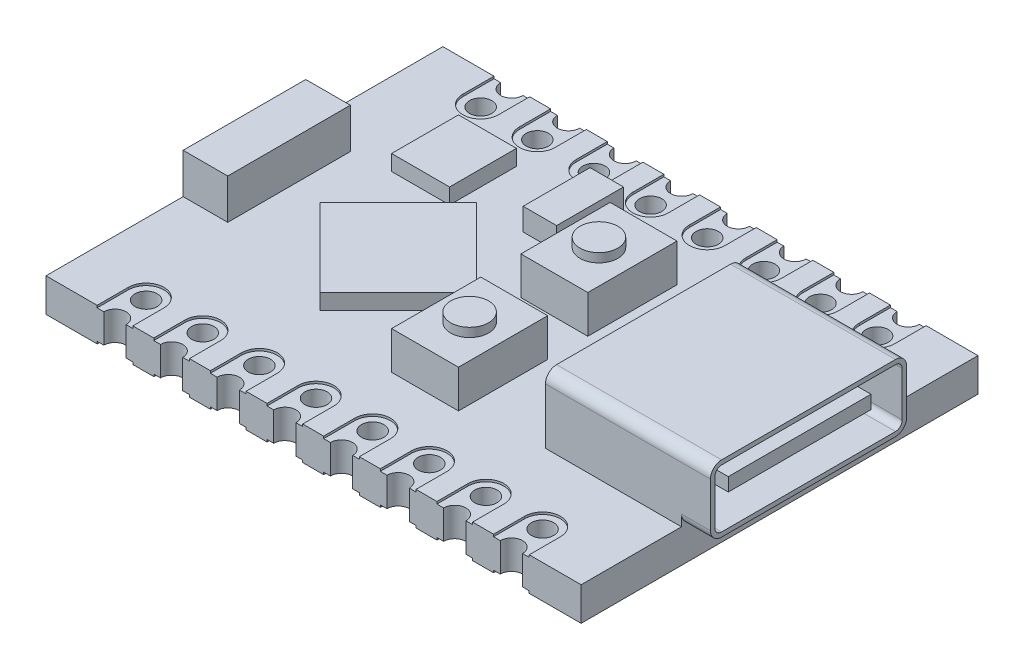
from build123d import *

# Parameters (mm, degrees)
SKETCH2_W             = 24
SKETCH2_H             = 17.8
BOSS_EXTRUDE1_DEPTH   = 1.5
SKETCH3_W             = 2
SKETCH3_H             = 5.5
BOSS_EXTRUDE2_DEPTH   = 1.8
BOSS_EXTRUDE3_DEPTH   = 0.7
SKETCH5_W             = 2.6
SKETCH5_H             = 3
BOSS_EXTRUDE4_DEPTH   = 0.7
SKETCH6_W             = 1.5
SKETCH6_H             = 3
BOSS_EXTRUDE5_DEPTH   = 1
SKETCH7_W             = 3
SKETCH7_H             = 4
BOSS_EXTRUDE6_DEPTH   = 1.7
SKETCH8_R             = 0.85
BOSS_EXTRUDE7_DEPTH   = 0.4
SKETCH9_R             = 0.5
CUT_EXTRUDE1_DEPTH    = 30.954131602
CUT_EXTRUDE2_DEPTH    = 0.1
LPATTERN1_COUNT       = 8
LPATTERN1_PITCH       = 2.54
SKETCH11_R            = 0.5
CUT_EXTRUDE3_DEPTH    = 30.954131602
MIRROR2_COPY_1_DEPTH  = 0.1
MIRROR2_COPY_2_DEPTH  = 0.1
MIRROR2_COPY_3_DEPTH  = 0.1
MIRROR2_COPY_4_DEPTH  = 0.1
MIRROR2_COPY_5_DEPTH  = 0.1
MIRROR2_COPY_6_DEPTH  = 0.1
MIRROR2_COPY_7_DEPTH  = 0.1
MIRROR2_COPY_8_DEPTH  = 0.1
MIRROR3_COPY_1_DEPTH  = 0.1
MIRROR3_COPY_2_DEPTH  = 0.1
MIRROR3_COPY_3_DEPTH  = 0.1
MIRROR3_COPY_4_DEPTH  = 0.1
MIRROR3_COPY_5_DEPTH  = 0.1
MIRROR3_COPY_6_DEPTH  = 0.1
MIRROR3_COPY_7_DEPTH  = 0.1
MIRROR3_COPY_8_DEPTH  = 0.1
MIRROR3_COPY_9_DEPTH  = 0.1
MIRROR3_COPY_10_DEPTH = 0.1
MIRROR3_COPY_11_DEPTH = 0.1
MIRROR3_COPY_12_DEPTH = 0.1
MIRROR3_COPY_13_DEPTH = 0.1
MIRROR3_COPY_14_DEPTH = 0.1
MIRROR3_COPY_15_DEPTH = 0.1
SKETCH12_W            = 8.8
SKETCH12_H            = 3
BOSS_EXTRUDE8_DEPTH   = 7.4
FILLET1_R             = 0.5
CUT_EXTRUDE4_DEPTH    = 6.4
SKETCH14_W            = 6.4
SKETCH14_H            = 0.6
BOSS_EXTRUDE9_DEPTH   = 6
SKETCH15_W            = 5.5
SKETCH15_H            = 0.01
CUT_EXTRUDE5_DEPTH    = 0.01


with BuildPart() as part:
    # Sketch2 → Boss-Extrude1 (new body)
    with BuildSketch(Plane(origin=(0, 0, 0), x_dir=(1, 0, 0), z_dir=(0, 1, 0))):
        with Locations((12, 8.9)):
            Rectangle(SKETCH2_W, SKETCH2_H)
    extrude(amount=-BOSS_EXTRUDE1_DEPTH)

    # Sketch3 → Boss-Extrude2 (add)
    with BuildSketch(Plane(origin=(0, 0, 0), x_dir=(1, 0, 0), z_dir=(0, 1, 0))):
        with Locations((1, 8.9)):
            Rectangle(SKETCH3_W, SKETCH3_H)
    extrude(amount=BOSS_EXTRUDE2_DEPTH)

    # Sketch4 → Boss-Extrude3 (add)
    with BuildSketch(Plane(origin=(0, 0, 0), x_dir=(1, 0, 0), z_dir=(0, 1, 0))):
        Polygon((4, 8.3), (7.5, 11.8), (11, 8.3), (7.5, 4.8), align=None)
    extrude(amount=BOSS_EXTRUDE3_DEPTH)

    # Sketch5 → Boss-Extrude4 (add)
    with BuildSketch(Plane(origin=(0, 0, 0), x_dir=(1, 0, 0), z_dir=(0, 1, 0))):
        with Locations((5, 13.3)):
            Rectangle(SKETCH5_W, SKETCH5_H)
    extrude(amount=BOSS_EXTRUDE4_DEPTH)

    # Sketch6 → Boss-Extrude5 (add)
    with BuildSketch(Plane(origin=(0, 0, 0), x_dir=(1, 0, 0), z_dir=(0, 1, 0))):
        with Locations((9.75, 13.9)):
            Rectangle(SKETCH6_W, SKETCH6_H)
    extrude(amount=BOSS_EXTRUDE5_DEPTH)

    # Sketch7 → Boss-Extrude6 (add)
    with BuildSketch(Plane(origin=(0, 0, 0), x_dir=(1, 0, 0), z_dir=(0, 1, 0))):
        with Locations((13, 11.8)):
            Rectangle(SKETCH7_W, SKETCH7_H)
    boss_extrude6 = extrude(amount=BOSS_EXTRUDE6_DEPTH)

    # Sketch8 → Boss-Extrude7 (add)
    with BuildSketch(Plane(origin=(0, 1.7, 0), x_dir=(1, 0, 0), z_dir=(0, 1, 0))):
        with Locations((13, 11.8)):
            Circle(SKETCH8_R)
    boss_extrude7 = extrude(amount=BOSS_EXTRUDE7_DEPTH)

    # Mirror1: Boss-Extrude6, Boss-Extrude7 across plane
    add(boss_extrude6.mirror(Plane(origin=(0, 0, -8.9), x_dir=(1, 0, 0), z_dir=(0, 0, -1))))
    add(boss_extrude7.mirror(Plane(origin=(0, 0, -8.9), x_dir=(1, 0, 0), z_dir=(0, 0, -1))))

    # Sketch9 → Cut-Extrude1 (cut, through all)
    with BuildSketch(Plane(origin=(0, 0, 0), x_dir=(1, 0, 0), z_dir=(0, 1, 0))):
        with Locations((3.093060381, 16.402666124)):
            Circle(SKETCH9_R)
        with Locations((5.633060381, 16.402666124)):
            Circle(SKETCH9_R)
        with Locations((8.173060381, 16.402666124)):
            Circle(SKETCH9_R)
        with Locations((10.713060381, 16.402666124)):
            Circle(SKETCH9_R)
        with Locations((13.253060381, 16.402666124)):
            Circle(SKETCH9_R)
        with Locations((15.793060381, 16.402666124)):
            Circle(SKETCH9_R)
        with Locations((18.333060381, 16.402666124)):
            Circle(SKETCH9_R)
        with Locations((20.873060381, 16.402666124)):
            Circle(SKETCH9_R)
    cut_extrude1 = extrude(amount=-CUT_EXTRUDE1_DEPTH, mode=Mode.SUBTRACT)

    # Sketch10 → Cut-Extrude2 (cut)
    with BuildSketch(Plane(origin=(0, 0, 0), x_dir=(1, 0, 0), z_dir=(0, 1, 0))):
        with BuildLine():
            Line((2.293060381, 16.402666124), (2.293060381, 17.8))
            Line((2.293060381, 17.8), (3.893060381, 17.8))
            Line((3.893060381, 17.8), (3.893060381, 16.402666124))
            ThreePointArc((3.893060381, 16.402666124), (3.093060381, 15.602666124), (2.293060381, 16.402666124))
        make_face()
    cut_extrude2 = extrude(amount=-CUT_EXTRUDE2_DEPTH, mode=Mode.SUBTRACT)

    # LPattern1: Cut-Extrude2 ×8
    with Locations(*[(i * LPATTERN1_PITCH, 0, 0) for i in range(1, LPATTERN1_COUNT)]):
        add(cut_extrude2, mode=Mode.SUBTRACT)

    # Sketch11 → Cut-Extrude3 (cut, through all)
    with BuildSketch(Plane(origin=(0, 0, 0), x_dir=(1, 0, 0), z_dir=(0, 1, 0))):
        with Locations((3.093060381, 17.8)):
            Circle(SKETCH11_R)
        with Locations((5.633060381, 17.8)):
            Circle(SKETCH11_R)
        with Locations((8.173060381, 17.8)):
            Circle(SKETCH11_R)
        with Locations((10.713060381, 17.8)):
            Circle(SKETCH11_R)
        with Locations((13.253060381, 17.8)):
            Circle(SKETCH11_R)
        with Locations((15.793060381, 17.8)):
            Circle(SKETCH11_R)
        with Locations((18.333060381, 17.8)):
            Circle(SKETCH11_R)
        with Locations((20.873060381, 17.8)):
            Circle(SKETCH11_R)
    cut_extrude3 = extrude(amount=-CUT_EXTRUDE3_DEPTH, mode=Mode.SUBTRACT)

    # Mirror2 copy 1 sketch → Mirror2 copy 1 (cut)
    with BuildSketch(Plane(origin=(2.54, -1.5, 0), x_dir=(1, 0, 0), z_dir=(0, -1, 0))):
        with BuildLine():
            Line((2.293060381, -16.402666124), (2.293060381, -17.8))
            Line((2.293060381, -17.8), (3.893060381, -17.8))
            Line((3.893060381, -17.8), (3.893060381, -16.402666124))
            ThreePointArc((3.893060381, -16.402666124), (3.093060381, -15.602666124), (2.293060381, -16.402666124))
        make_face()
    extrude(amount=-MIRROR2_COPY_1_DEPTH, mode=Mode.SUBTRACT)

    # Mirror2 copy 2 sketch → Mirror2 copy 2 (cut)
    with BuildSketch(Plane(origin=(5.08, -1.5, 0), x_dir=(1, 0, 0), z_dir=(0, -1, 0))):
        with BuildLine():
            Line((2.293060381, -16.402666124), (2.293060381, -17.8))
            Line((2.293060381, -17.8), (3.893060381, -17.8))
            Line((3.893060381, -17.8), (3.893060381, -16.402666124))
            ThreePointArc((3.893060381, -16.402666124), (3.093060381, -15.602666124), (2.293060381, -16.402666124))
        make_face()
    extrude(amount=-MIRROR2_COPY_2_DEPTH, mode=Mode.SUBTRACT)

    # Mirror2 copy 3 sketch → Mirror2 copy 3 (cut)
    with BuildSketch(Plane(origin=(7.62, -1.5, 0), x_dir=(1, 0, 0), z_dir=(0, -1, 0))):
        with BuildLine():
            Line((2.293060381, -16.402666124), (2.293060381, -17.8))
            Line((2.293060381, -17.8), (3.893060381, -17.8))
            Line((3.893060381, -17.8), (3.893060381, -16.402666124))
            ThreePointArc((3.893060381, -16.402666124), (3.093060381, -15.602666124), (2.293060381, -16.402666124))
        make_face()
    extrude(amount=-MIRROR2_COPY_3_DEPTH, mode=Mode.SUBTRACT)

    # Mirror2 copy 4 sketch → Mirror2 copy 4 (cut)
    with BuildSketch(Plane(origin=(10.16, -1.5, 0), x_dir=(1, 0, 0), z_dir=(0, -1, 0))):
        with BuildLine():
            Line((2.293060381, -16.402666124), (2.293060381, -17.8))
            Line((2.293060381, -17.8), (3.893060381, -17.8))
            Line((3.893060381, -17.8), (3.893060381, -16.402666124))
            ThreePointArc((3.893060381, -16.402666124), (3.093060381, -15.602666124), (2.293060381, -16.402666124))
        make_face()
    extrude(amount=-MIRROR2_COPY_4_DEPTH, mode=Mode.SUBTRACT)

    # Mirror2 copy 5 sketch → Mirror2 copy 5 (cut)
    with BuildSketch(Plane(origin=(12.7, -1.5, 0), x_dir=(1, 0, 0), z_dir=(0, -1, 0))):
        with BuildLine():
            Line((2.293060381, -16.402666124), (2.293060381, -17.8))
            Line((2.293060381, -17.8), (3.893060381, -17.8))
            Line((3.893060381, -17.8), (3.893060381, -16.402666124))
            ThreePointArc((3.893060381, -16.402666124), (3.093060381, -15.602666124), (2.293060381, -16.402666124))
        make_face()
    extrude(amount=-MIRROR2_COPY_5_DEPTH, mode=Mode.SUBTRACT)

    # Mirror2 copy 6 sketch → Mirror2 copy 6 (cut)
    with BuildSketch(Plane(origin=(15.24, -1.5, 0), x_dir=(1, 0, 0), z_dir=(0, -1, 0))):
        with BuildLine():
            Line((2.293060381, -16.402666124), (2.293060381, -17.8))
            Line((2.293060381, -17.8), (3.893060381, -17.8))
            Line((3.893060381, -17.8), (3.893060381, -16.402666124))
            ThreePointArc((3.893060381, -16.402666124), (3.093060381, -15.602666124), (2.293060381, -16.402666124))
        make_face()
    extrude(amount=-MIRROR2_COPY_6_DEPTH, mode=Mode.SUBTRACT)

    # Mirror2 copy 7 sketch → Mirror2 copy 7 (cut)
    with BuildSketch(Plane(origin=(17.78, -1.5, 0), x_dir=(1, 0, 0), z_dir=(0, -1, 0))):
        with BuildLine():
            Line((2.293060381, -16.402666124), (2.293060381, -17.8))
            Line((2.293060381, -17.8), (3.893060381, -17.8))
            Line((3.893060381, -17.8), (3.893060381, -16.402666124))
            ThreePointArc((3.893060381, -16.402666124), (3.093060381, -15.602666124), (2.293060381, -16.402666124))
        make_face()
    extrude(amount=-MIRROR2_COPY_7_DEPTH, mode=Mode.SUBTRACT)

    # Mirror2 copy 8 sketch → Mirror2 copy 8 (cut)
    with BuildSketch(Plane.XZ.offset(1.5)):
        with BuildLine():
            Line((2.293060381, -16.402666124), (2.293060381, -17.8))
            Line((2.293060381, -17.8), (3.893060381, -17.8))
            Line((3.893060381, -17.8), (3.893060381, -16.402666124))
            ThreePointArc((3.893060381, -16.402666124), (3.093060381, -15.602666124), (2.293060381, -16.402666124))
        make_face()
    extrude(amount=-MIRROR2_COPY_8_DEPTH, mode=Mode.SUBTRACT)

    # Mirror3: Cut-Extrude1, Cut-Extrude2, Cut-Extrude3 across plane
    add(cut_extrude1.mirror(Plane(origin=(0, 0, -8.9), x_dir=(1, 0, 0), z_dir=(0, 0, -1))), mode=Mode.SUBTRACT)
    add(cut_extrude2.mirror(Plane(origin=(0, 0, -8.9), x_dir=(1, 0, 0), z_dir=(0, 0, -1))), mode=Mode.SUBTRACT)
    add(cut_extrude3.mirror(Plane(origin=(0, 0, -8.9), x_dir=(1, 0, 0), z_dir=(0, 0, -1))), mode=Mode.SUBTRACT)

    # Mirror3 copy 1 sketch → Mirror3 copy 1 (cut)
    with BuildSketch(Plane(origin=(2.54, 0, -17.8), x_dir=(1, 0, 0), z_dir=(0, 1, 0))):
        with BuildLine():
            Line((2.293060381, -16.402666124), (2.293060381, -17.8))
            Line((2.293060381, -17.8), (3.893060381, -17.8))
            Line((3.893060381, -17.8), (3.893060381, -16.402666124))
            ThreePointArc((3.893060381, -16.402666124), (3.093060381, -15.602666124), (2.293060381, -16.402666124))
        make_face()
    extrude(amount=-MIRROR3_COPY_1_DEPTH, mode=Mode.SUBTRACT)

    # Mirror3 copy 2 sketch → Mirror3 copy 2 (cut)
    with BuildSketch(Plane(origin=(5.08, 0, -17.8), x_dir=(1, 0, 0), z_dir=(0, 1, 0))):
        with BuildLine():
            Line((2.293060381, -16.402666124), (2.293060381, -17.8))
            Line((2.293060381, -17.8), (3.893060381, -17.8))
            Line((3.893060381, -17.8), (3.893060381, -16.402666124))
            ThreePointArc((3.893060381, -16.402666124), (3.093060381, -15.602666124), (2.293060381, -16.402666124))
        make_face()
    extrude(amount=-MIRROR3_COPY_2_DEPTH, mode=Mode.SUBTRACT)

    # Mirror3 copy 3 sketch → Mirror3 copy 3 (cut)
    with BuildSketch(Plane(origin=(7.62, 0, -17.8), x_dir=(1, 0, 0), z_dir=(0, 1, 0))):
        with BuildLine():
            Line((2.293060381, -16.402666124), (2.293060381, -17.8))
            Line((2.293060381, -17.8), (3.893060381, -17.8))
            Line((3.893060381, -17.8), (3.893060381, -16.402666124))
            ThreePointArc((3.893060381, -16.402666124), (3.093060381, -15.602666124), (2.293060381, -16.402666124))
        make_face()
    extrude(amount=-MIRROR3_COPY_3_DEPTH, mode=Mode.SUBTRACT)

    # Mirror3 copy 4 sketch → Mirror3 copy 4 (cut)
    with BuildSketch(Plane(origin=(10.16, 0, -17.8), x_dir=(1, 0, 0), z_dir=(0, 1, 0))):
        with BuildLine():
            Line((2.293060381, -16.402666124), (2.293060381, -17.8))
            Line((2.293060381, -17.8), (3.893060381, -17.8))
            Line((3.893060381, -17.8), (3.893060381, -16.402666124))
            ThreePointArc((3.893060381, -16.402666124), (3.093060381, -15.602666124), (2.293060381, -16.402666124))
        make_face()
    extrude(amount=-MIRROR3_COPY_4_DEPTH, mode=Mode.SUBTRACT)

    # Mirror3 copy 5 sketch → Mirror3 copy 5 (cut)
    with BuildSketch(Plane(origin=(12.7, 0, -17.8), x_dir=(1, 0, 0), z_dir=(0, 1, 0))):
        with BuildLine():
            Line((2.293060381, -16.402666124), (2.293060381, -17.8))
            Line((2.293060381, -17.8), (3.893060381, -17.8))
            Line((3.893060381, -17.8), (3.893060381, -16.402666124))
            ThreePointArc((3.893060381, -16.402666124), (3.093060381, -15.602666124), (2.293060381, -16.402666124))
        make_face()
    extrude(amount=-MIRROR3_COPY_5_DEPTH, mode=Mode.SUBTRACT)

    # Mirror3 copy 6 sketch → Mirror3 copy 6 (cut)
    with BuildSketch(Plane(origin=(15.24, 0, -17.8), x_dir=(1, 0, 0), z_dir=(0, 1, 0))):
        with BuildLine():
            Line((2.293060381, -16.402666124), (2.293060381, -17.8))
            Line((2.293060381, -17.8), (3.893060381, -17.8))
            Line((3.893060381, -17.8), (3.893060381, -16.402666124))
            ThreePointArc((3.893060381, -16.402666124), (3.093060381, -15.602666124), (2.293060381, -16.402666124))
        make_face()
    extrude(amount=-MIRROR3_COPY_6_DEPTH, mode=Mode.SUBTRACT)

    # Mirror3 copy 7 sketch → Mirror3 copy 7 (cut)
    with BuildSketch(Plane(origin=(17.78, 0, -17.8), x_dir=(1, 0, 0), z_dir=(0, 1, 0))):
        with BuildLine():
            Line((2.293060381, -16.402666124), (2.293060381, -17.8))
            Line((2.293060381, -17.8), (3.893060381, -17.8))
            Line((3.893060381, -17.8), (3.893060381, -16.402666124))
            ThreePointArc((3.893060381, -16.402666124), (3.093060381, -15.602666124), (2.293060381, -16.402666124))
        make_face()
    extrude(amount=-MIRROR3_COPY_7_DEPTH, mode=Mode.SUBTRACT)

    # Mirror3 copy 8 sketch → Mirror3 copy 8 (cut)
    with BuildSketch(Plane(origin=(2.54, -1.5, -17.8), x_dir=(1, 0, 0), z_dir=(0, -1, 0))):
        with BuildLine():
            Line((2.293060381, 16.402666124), (2.293060381, 17.8))
            Line((2.293060381, 17.8), (3.893060381, 17.8))
            Line((3.893060381, 17.8), (3.893060381, 16.402666124))
            ThreePointArc((3.893060381, 16.402666124), (3.093060381, 15.602666124), (2.293060381, 16.402666124))
        make_face()
    extrude(amount=-MIRROR3_COPY_8_DEPTH, mode=Mode.SUBTRACT)

    # Mirror3 copy 9 sketch → Mirror3 copy 9 (cut)
    with BuildSketch(Plane(origin=(5.08, -1.5, -17.8), x_dir=(1, 0, 0), z_dir=(0, -1, 0))):
        with BuildLine():
            Line((2.293060381, 16.402666124), (2.293060381, 17.8))
            Line((2.293060381, 17.8), (3.893060381, 17.8))
            Line((3.893060381, 17.8), (3.893060381, 16.402666124))
            ThreePointArc((3.893060381, 16.402666124), (3.093060381, 15.602666124), (2.293060381, 16.402666124))
        make_face()
    extrude(amount=-MIRROR3_COPY_9_DEPTH, mode=Mode.SUBTRACT)

    # Mirror3 copy 10 sketch → Mirror3 copy 10 (cut)
    with BuildSketch(Plane(origin=(7.62, -1.5, -17.8), x_dir=(1, 0, 0), z_dir=(0, -1, 0))):
        with BuildLine():
            Line((2.293060381, 16.402666124), (2.293060381, 17.8))
            Line((2.293060381, 17.8), (3.893060381, 17.8))
            Line((3.893060381, 17.8), (3.893060381, 16.402666124))
            ThreePointArc((3.893060381, 16.402666124), (3.093060381, 15.602666124), (2.293060381, 16.402666124))
        make_face()
    extrude(amount=-MIRROR3_COPY_10_DEPTH, mode=Mode.SUBTRACT)

    # Mirror3 copy 11 sketch → Mirror3 copy 11 (cut)
    with BuildSketch(Plane(origin=(10.16, -1.5, -17.8), x_dir=(1, 0, 0), z_dir=(0, -1, 0))):
        with BuildLine():
            Line((2.293060381, 16.402666124), (2.293060381, 17.8))
            Line((2.293060381, 17.8), (3.893060381, 17.8))
            Line((3.893060381, 17.8), (3.893060381, 16.402666124))
            ThreePointArc((3.893060381, 16.402666124), (3.093060381, 15.602666124), (2.293060381, 16.402666124))
        make_face()
    extrude(amount=-MIRROR3_COPY_11_DEPTH, mode=Mode.SUBTRACT)

    # Mirror3 copy 12 sketch → Mirror3 copy 12 (cut)
    with BuildSketch(Plane(origin=(12.7, -1.5, -17.8), x_dir=(1, 0, 0), z_dir=(0, -1, 0))):
        with BuildLine():
            Line((2.293060381, 16.402666124), (2.293060381, 17.8))
            Line((2.293060381, 17.8), (3.893060381, 17.8))
            Line((3.893060381, 17.8), (3.893060381, 16.402666124))
            ThreePointArc((3.893060381, 16.402666124), (3.093060381, 15.602666124), (2.293060381, 16.402666124))
        make_face()
    extrude(amount=-MIRROR3_COPY_12_DEPTH, mode=Mode.SUBTRACT)

    # Mirror3 copy 13 sketch → Mirror3 copy 13 (cut)
    with BuildSketch(Plane(origin=(15.24, -1.5, -17.8), x_dir=(1, 0, 0), z_dir=(0, -1, 0))):
        with BuildLine():
            Line((2.293060381, 16.402666124), (2.293060381, 17.8))
            Line((2.293060381, 17.8), (3.893060381, 17.8))
            Line((3.893060381, 17.8), (3.893060381, 16.402666124))
            ThreePointArc((3.893060381, 16.402666124), (3.093060381, 15.602666124), (2.293060381, 16.402666124))
        make_face()
    extrude(amount=-MIRROR3_COPY_13_DEPTH, mode=Mode.SUBTRACT)

    # Mirror3 copy 14 sketch → Mirror3 copy 14 (cut)
    with BuildSketch(Plane(origin=(17.78, -1.5, -17.8), x_dir=(1, 0, 0), z_dir=(0, -1, 0))):
        with BuildLine():
            Line((2.293060381, 16.402666124), (2.293060381, 17.8))
            Line((2.293060381, 17.8), (3.893060381, 17.8))
            Line((3.893060381, 17.8), (3.893060381, 16.402666124))
            ThreePointArc((3.893060381, 16.402666124), (3.093060381, 15.602666124), (2.293060381, 16.402666124))
        make_face()
    extrude(amount=-MIRROR3_COPY_14_DEPTH, mode=Mode.SUBTRACT)

    # Mirror3 copy 15 sketch → Mirror3 copy 15 (cut)
    with BuildSketch(Plane(origin=(0, -1.5, -17.8), x_dir=(1, 0, 0), z_dir=(0, -1, 0))):
        with BuildLine():
            Line((2.293060381, 16.402666124), (2.293060381, 17.8))
            Line((2.293060381, 17.8), (3.893060381, 17.8))
            Line((3.893060381, 17.8), (3.893060381, 16.402666124))
            ThreePointArc((3.893060381, 16.402666124), (3.093060381, 15.602666124), (2.293060381, 16.402666124))
        make_face()
    extrude(amount=-MIRROR3_COPY_15_DEPTH, mode=Mode.SUBTRACT)

    # Sketch12 → Boss-Extrude8 (add)
    with BuildSketch(Plane(origin=(25.3, 0, 0), x_dir=(0, 0, -1), z_dir=(1, 0, 0))):
        with Locations((8.9, 1.5)):
            Rectangle(SKETCH12_W, SKETCH12_H)
    extrude(amount=-BOSS_EXTRUDE8_DEPTH)

    # Fillet1
    fillet1_edges = [part.edges().sort_by_distance(p)[0] for p in [
        (24.65, 0, -4.5),
        (24.65, 0, -13.3),
        (21.6, 3, -13.3),
        (21.6, 3, -4.5),
    ]]
    fillet(fillet1_edges, radius=FILLET1_R)

    # Sketch13 → Cut-Extrude4 (cut)
    with BuildSketch(Plane(origin=(25.3, 0, 0), x_dir=(0, 0, -1), z_dir=(1, 0, 0))):
        with BuildLine():
            ThreePointArc((5, 2.8), (4.787867966, 2.712132034), (4.7, 2.5))
            Line((4.7, 2.5), (4.7, 0.5))
            ThreePointArc((4.7, 0.5), (4.787867966, 0.287867966), (5, 0.2))
            Line((5, 0.2), (12.8, 0.2))
            ThreePointArc((12.8, 0.2), (13.012132034, 0.287867966), (13.1, 0.5))
            Line((13.1, 0.5), (13.1, 2.5))
            ThreePointArc((13.1, 2.5), (13.012132034, 2.712132034), (12.8, 2.8))
            Line((12.8, 2.8), (5, 2.8))
        make_face()
    extrude(amount=-CUT_EXTRUDE4_DEPTH, mode=Mode.SUBTRACT)

    # Sketch14 → Boss-Extrude9 (add)
    with BuildSketch(Plane(origin=(18.9, 0, 0), x_dir=(0, 0, -1), z_dir=(1, 0, 0))):
        with Locations((8.9, 1.5)):
            Rectangle(SKETCH14_W, SKETCH14_H)
    extrude(amount=BOSS_EXTRUDE9_DEPTH)

    # Sketch15 → Cut-Extrude5 (cut)
    with BuildSketch(Plane.ZY):
        with Locations((-8.9, 0.005)):
            Rectangle(SKETCH15_W, SKETCH15_H)
    extrude(amount=-CUT_EXTRUDE5_DEPTH, mode=Mode.SUBTRACT)


solid = part.part
